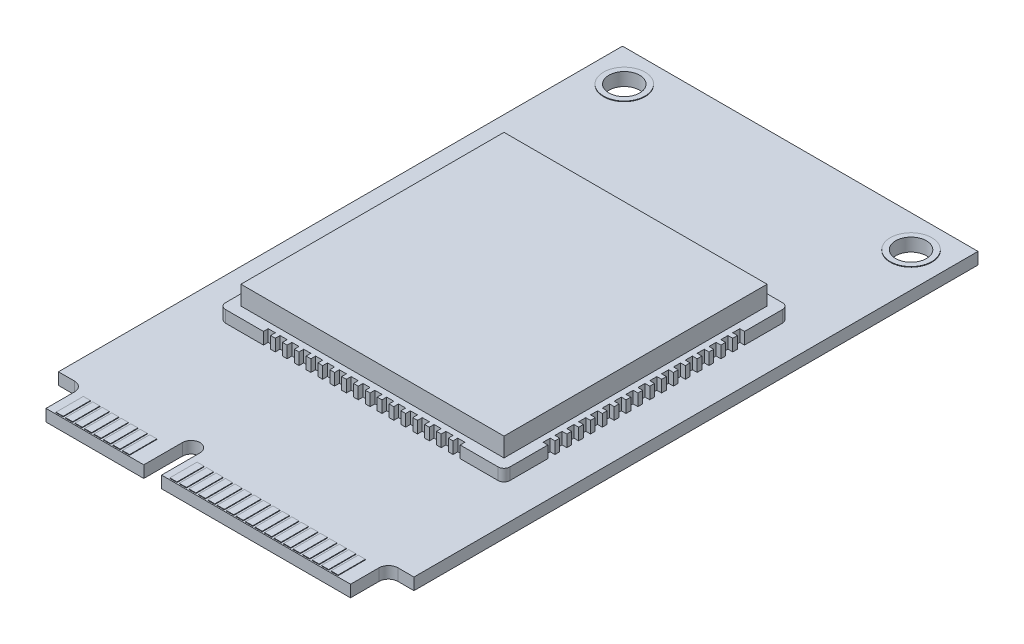
from build123d import *

# Parameters (mm, degrees)
SKETCH1_R           = 1.3
BOSS_EXTRUDE1_DEPTH = 1
SKETCH2_R           = 1.75
SKETCH2_R_2         = 1.3
SKETCH2_W           = 0.6
SKETCH2_H           = 2.3
BOSS_EXTRUDE2_DEPTH = 0.05
BOSS_EXTRUDE3_DEPTH = 1
SKETCH4_W           = 22.2
SKETCH4_H           = 22.2
BOSS_EXTRUDE4_DEPTH = 1.6


with BuildPart() as part:
    # Sketch1 → Boss-Extrude1 (new body)
    with BuildSketch(Plane(origin=(0, 0, 0), x_dir=(1, 0, 0), z_dir=(0, 1, 0))):
        with BuildLine():
            Line((-15, -23.8), (-13.65, -23.8))
            ThreePointArc((-13.65, -23.8), (-13.084314575, -24.034314575), (-12.85, -24.6))
            Line((-12.85, -24.6), (-12.85, -27))
            Line((-12.85, -27), (-4.6, -27))
            Line((-4.6, -27), (-4.6, -23.75))
            ThreePointArc((-4.6, -23.75), (-3.85, -23), (-3.1, -23.75))
            Line((-3.1, -23.75), (-3.1, -27))
            Line((-3.1, -27), (12.85, -27))
            Line((12.85, -27), (12.85, -24.6))
            ThreePointArc((12.85, -24.6), (13.084314575, -24.034314575), (13.65, -23.8))
            Line((13.65, -23.8), (15, -23.8))
            Line((15, -23.8), (15, 23.8))
            Line((15, 23.8), (-15, 23.8))
            Line((-15, 23.8), (-15, -23.8))
        make_face()
        with Locations((12.1, 21.05)):
            Circle(SKETCH1_R, mode=Mode.SUBTRACT)
        with Locations((-12.1, 21.05)):
            Circle(SKETCH1_R, mode=Mode.SUBTRACT)
    extrude(amount=BOSS_EXTRUDE1_DEPTH)

    # Sketch2 → Boss-Extrude2 (add)
    # profile 1 of 28: a face of its own
    with BuildSketch(Plane(origin=(0, 1, 0), x_dir=(1, 0, 0), z_dir=(0, 1, 0))):
        with Locations((-12.1, 21.05)):
            Circle(SKETCH2_R)
        with Locations((-12.1, 21.05)):
            Circle(SKETCH2_R_2, mode=Mode.SUBTRACT)
    # profile 2 of 28: a face of its own
    with BuildSketch(Plane(origin=(0, 1, 0), x_dir=(1, 0, 0), z_dir=(0, 1, 0))):
        with Locations((12.1, 21.05)):
            Circle(SKETCH2_R)
        with Locations((12.1, 21.05)):
            Circle(SKETCH2_R_2, mode=Mode.SUBTRACT)
    # profile 3 of 28: a face of its own
    with BuildSketch(Plane(origin=(0, 1, 0), x_dir=(1, 0, 0), z_dir=(0, 1, 0))):
        with Locations((-6.2, -25.75)):
            Rectangle(SKETCH2_W, SKETCH2_H)
    # profile 4 of 28: a face of its own
    with BuildSketch(Plane(origin=(0, 1, 0), x_dir=(1, 0, 0), z_dir=(0, 1, 0))):
        with Locations((-7, -25.75)):
            Rectangle(SKETCH2_W, SKETCH2_H)
    # profile 5 of 28: a face of its own
    with BuildSketch(Plane(origin=(0, 1, 0), x_dir=(1, 0, 0), z_dir=(0, 1, 0))):
        with Locations((-7.8, -25.75)):
            Rectangle(SKETCH2_W, SKETCH2_H)
    # profile 6 of 28: a face of its own
    with BuildSketch(Plane(origin=(0, 1, 0), x_dir=(1, 0, 0), z_dir=(0, 1, 0))):
        with Locations((-8.6, -25.75)):
            Rectangle(SKETCH2_W, SKETCH2_H)
    # profile 7 of 28: a face of its own
    with BuildSketch(Plane(origin=(0, 1, 0), x_dir=(1, 0, 0), z_dir=(0, 1, 0))):
        with Locations((-9.4, -25.75)):
            Rectangle(SKETCH2_W, SKETCH2_H)
    # profile 8 of 28: a face of its own
    with BuildSketch(Plane(origin=(0, 1, 0), x_dir=(1, 0, 0), z_dir=(0, 1, 0))):
        with Locations((-10.2, -25.75)):
            Rectangle(SKETCH2_W, SKETCH2_H)
    # profile 9 of 28: a face of its own
    with BuildSketch(Plane(origin=(0, 1, 0), x_dir=(1, 0, 0), z_dir=(0, 1, 0))):
        with Locations((-11, -25.75)):
            Rectangle(SKETCH2_W, SKETCH2_H)
    # profile 10 of 28: a face of its own
    with BuildSketch(Plane(origin=(0, 1, 0), x_dir=(1, 0, 0), z_dir=(0, 1, 0))):
        with Locations((-11.8, -25.75)):
            Rectangle(SKETCH2_W, SKETCH2_H)
    # profile 11 of 28: a face of its own
    with BuildSketch(Plane(origin=(0, 1, 0), x_dir=(1, 0, 0), z_dir=(0, 1, 0))):
        with Locations((-2.2, -25.75)):
            Rectangle(SKETCH2_W, SKETCH2_H)
    # profile 12 of 28: a face of its own
    with BuildSketch(Plane(origin=(0, 1, 0), x_dir=(1, 0, 0), z_dir=(0, 1, 0))):
        with Locations((-1.4, -25.75)):
            Rectangle(SKETCH2_W, SKETCH2_H)
    # profile 13 of 28: a face of its own
    with BuildSketch(Plane(origin=(0, 1, 0), x_dir=(1, 0, 0), z_dir=(0, 1, 0))):
        with Locations((-0.6, -25.75)):
            Rectangle(SKETCH2_W, SKETCH2_H)
    # profile 14 of 28: a face of its own
    with BuildSketch(Plane(origin=(0, 1, 0), x_dir=(1, 0, 0), z_dir=(0, 1, 0))):
        with Locations((0.2, -25.75)):
            Rectangle(SKETCH2_W, SKETCH2_H)
    # profile 15 of 28: a face of its own
    with BuildSketch(Plane(origin=(0, 1, 0), x_dir=(1, 0, 0), z_dir=(0, 1, 0))):
        with Locations((1, -25.75)):
            Rectangle(SKETCH2_W, SKETCH2_H)
    # profile 16 of 28: a face of its own
    with BuildSketch(Plane(origin=(0, 1, 0), x_dir=(1, 0, 0), z_dir=(0, 1, 0))):
        with Locations((1.8, -25.75)):
            Rectangle(SKETCH2_W, SKETCH2_H)
    # profile 17 of 28: a face of its own
    with BuildSketch(Plane(origin=(0, 1, 0), x_dir=(1, 0, 0), z_dir=(0, 1, 0))):
        with Locations((2.6, -25.75)):
            Rectangle(SKETCH2_W, SKETCH2_H)
    # profile 18 of 28: a face of its own
    with BuildSketch(Plane(origin=(0, 1, 0), x_dir=(1, 0, 0), z_dir=(0, 1, 0))):
        with Locations((3.4, -25.75)):
            Rectangle(SKETCH2_W, SKETCH2_H)
    # profile 19 of 28: a face of its own
    with BuildSketch(Plane(origin=(0, 1, 0), x_dir=(1, 0, 0), z_dir=(0, 1, 0))):
        with Locations((4.2, -25.75)):
            Rectangle(SKETCH2_W, SKETCH2_H)
    # profile 20 of 28: a face of its own
    with BuildSketch(Plane(origin=(0, 1, 0), x_dir=(1, 0, 0), z_dir=(0, 1, 0))):
        with Locations((5, -25.75)):
            Rectangle(SKETCH2_W, SKETCH2_H)
    # profile 21 of 28: a face of its own
    with BuildSketch(Plane(origin=(0, 1, 0), x_dir=(1, 0, 0), z_dir=(0, 1, 0))):
        with Locations((5.8, -25.75)):
            Rectangle(SKETCH2_W, SKETCH2_H)
    # profile 22 of 28: a face of its own
    with BuildSketch(Plane(origin=(0, 1, 0), x_dir=(1, 0, 0), z_dir=(0, 1, 0))):
        with Locations((6.6, -25.75)):
            Rectangle(SKETCH2_W, SKETCH2_H)
    # profile 23 of 28: a face of its own
    with BuildSketch(Plane(origin=(0, 1, 0), x_dir=(1, 0, 0), z_dir=(0, 1, 0))):
        with Locations((7.4, -25.75)):
            Rectangle(SKETCH2_W, SKETCH2_H)
    # profile 24 of 28: a face of its own
    with BuildSketch(Plane(origin=(0, 1, 0), x_dir=(1, 0, 0), z_dir=(0, 1, 0))):
        with Locations((8.2, -25.75)):
            Rectangle(SKETCH2_W, SKETCH2_H)
    # profile 25 of 28: a face of its own
    with BuildSketch(Plane(origin=(0, 1, 0), x_dir=(1, 0, 0), z_dir=(0, 1, 0))):
        with Locations((9, -25.75)):
            Rectangle(SKETCH2_W, SKETCH2_H)
    # profile 26 of 28: a face of its own
    with BuildSketch(Plane(origin=(0, 1, 0), x_dir=(1, 0, 0), z_dir=(0, 1, 0))):
        with Locations((9.8, -25.75)):
            Rectangle(SKETCH2_W, SKETCH2_H)
    # profile 27 of 28: a face of its own
    with BuildSketch(Plane(origin=(0, 1, 0), x_dir=(1, 0, 0), z_dir=(0, 1, 0))):
        with Locations((10.6, -25.75)):
            Rectangle(SKETCH2_W, SKETCH2_H)
    # profile 28 of 28: a face of its own
    with BuildSketch(Plane(origin=(0, 1, 0), x_dir=(1, 0, 0), z_dir=(0, 1, 0))):
        with Locations((11.4, -25.75)):
            Rectangle(SKETCH2_W, SKETCH2_H)
    boss_extrude2 = extrude(amount=BOSS_EXTRUDE2_DEPTH)

    # Mirror1: Boss-Extrude2 across plane
    add(boss_extrude2.mirror(Plane.ZX.offset(0.5)))

    # Sketch3 → Boss-Extrude3 (add)
    with BuildSketch(Plane(origin=(0, 1, 0), x_dir=(1, 0, 0), z_dir=(0, 1, 0))):
        with BuildLine():
            Line((-8.3, 10.8), (-11.5, 10.8))
            ThreePointArc((-11.5, 10.8), (-11.853553391, 10.653553391), (-12, 10.3))
            Line((-12, 10.3), (-12, 7.1))
            Line((-12, 7.1), (-11.6, 7.1))
            Line((-11.6, 7.1), (-11.6, 6.5))
            Line((-11.6, 6.5), (-12, 6.5))
            Line((-12, 6.5), (-12, 6.1))
            Line((-12, 6.1), (-11.6, 6.1))
            Line((-11.6, 6.1), (-11.6, 5.5))
            Line((-11.6, 5.5), (-12, 5.5))
            Line((-12, 5.5), (-12, 5.1))
            Line((-12, 5.1), (-11.6, 5.1))
            Line((-11.6, 5.1), (-11.6, 4.5))
            Line((-11.6, 4.5), (-12, 4.5))
            Line((-12, 4.5), (-12, 4.1))
            Line((-12, 4.1), (-11.6, 4.1))
            Line((-11.6, 4.1), (-11.6, 3.5))
            Line((-11.6, 3.5), (-12, 3.5))
            Line((-12, 3.5), (-12, 3.1))
            Line((-12, 3.1), (-11.6, 3.1))
            Line((-11.6, 3.1), (-11.6, 2.5))
            Line((-11.6, 2.5), (-12, 2.5))
            Line((-12, 2.5), (-12, 2.1))
            Line((-12, 2.1), (-11.6, 2.1))
            Line((-11.6, 2.1), (-11.6, 1.5))
            Line((-11.6, 1.5), (-12, 1.5))
            Line((-12, 1.5), (-12, 1.1))
            Line((-12, 1.1), (-11.6, 1.1))
            Line((-11.6, 1.1), (-11.6, 0.5))
            Line((-11.6, 0.5), (-12, 0.5))
            Line((-12, 0.5), (-12, 0.1))
            Line((-12, 0.1), (-11.6, 0.1))
            Line((-11.6, 0.1), (-11.6, -0.5))
            Line((-11.6, -0.5), (-12, -0.5))
            Line((-12, -0.5), (-12, -0.9))
            Line((-12, -0.9), (-11.6, -0.9))
            Line((-11.6, -0.9), (-11.6, -1.5))
            Line((-11.6, -1.5), (-12, -1.5))
            Line((-12, -1.5), (-12, -1.9))
            Line((-12, -1.9), (-11.6, -1.9))
            Line((-11.6, -1.9), (-11.6, -2.5))
            Line((-11.6, -2.5), (-12, -2.5))
            Line((-12, -2.5), (-12, -2.9))
            Line((-12, -2.9), (-11.6, -2.9))
            Line((-11.6, -2.9), (-11.6, -3.5))
            Line((-11.6, -3.5), (-12, -3.5))
            Line((-12, -3.5), (-12, -3.9))
            Line((-12, -3.9), (-11.6, -3.9))
            Line((-11.6, -3.9), (-11.6, -4.5))
            Line((-11.6, -4.5), (-12, -4.5))
            Line((-12, -4.5), (-12, -4.9))
            Line((-12, -4.9), (-11.6, -4.9))
            Line((-11.6, -4.9), (-11.6, -5.5))
            Line((-11.6, -5.5), (-12, -5.5))
            Line((-12, -5.5), (-12, -5.9))
            Line((-12, -5.9), (-11.6, -5.9))
            Line((-11.6, -5.9), (-11.6, -6.5))
            Line((-11.6, -6.5), (-12, -6.5))
            Line((-12, -6.5), (-12, -6.9))
            Line((-12, -6.9), (-11.6, -6.9))
            Line((-11.6, -6.9), (-11.6, -7.5))
            Line((-11.6, -7.5), (-12, -7.5))
            Line((-12, -7.5), (-12, -7.9))
            Line((-12, -7.9), (-11.6, -7.9))
            Line((-11.6, -7.9), (-11.6, -8.5))
            Line((-11.6, -8.5), (-12, -8.5))
            Line((-12, -8.5), (-12, -8.9))
            Line((-12, -8.9), (-11.6, -8.9))
            Line((-11.6, -8.9), (-11.6, -9.5))
            Line((-11.6, -9.5), (-12, -9.5))
            Line((-12, -9.5), (-12, -12.7))
            ThreePointArc((-12, -12.7), (-11.853553391, -13.053553391), (-11.5, -13.2))
            Line((-11.5, -13.2), (-8.3, -13.2))
            Line((-8.3, -13.2), (-8.3, -12.8))
            Line((-8.3, -12.8), (-7.7, -12.8))
            Line((-7.7, -12.8), (-7.7, -13.2))
            Line((-7.7, -13.2), (-7.3, -13.2))
            Line((-7.3, -13.2), (-7.3, -12.8))
            Line((-7.3, -12.8), (-6.7, -12.8))
            Line((-6.7, -12.8), (-6.7, -13.2))
            Line((-6.7, -13.2), (-6.3, -13.2))
            Line((-6.3, -13.2), (-6.3, -12.8))
            Line((-6.3, -12.8), (-5.7, -12.8))
            Line((-5.7, -12.8), (-5.7, -13.2))
            Line((-5.7, -13.2), (-5.3, -13.2))
            Line((-5.3, -13.2), (-5.3, -12.8))
            Line((-5.3, -12.8), (-4.7, -12.8))
            Line((-4.7, -12.8), (-4.7, -13.2))
            Line((-4.7, -13.2), (-4.3, -13.2))
            Line((-4.3, -13.2), (-4.3, -12.8))
            Line((-4.3, -12.8), (-3.7, -12.8))
            Line((-3.7, -12.8), (-3.7, -13.2))
            Line((-3.7, -13.2), (-3.3, -13.2))
            Line((-3.3, -13.2), (-3.3, -12.8))
            Line((-3.3, -12.8), (-2.7, -12.8))
            Line((-2.7, -12.8), (-2.7, -13.2))
            Line((-2.7, -13.2), (-2.3, -13.2))
            Line((-2.3, -13.2), (-2.3, -12.8))
            Line((-2.3, -12.8), (-1.7, -12.8))
            Line((-1.7, -12.8), (-1.7, -13.2))
            Line((-1.7, -13.2), (-1.3, -13.2))
            Line((-1.3, -13.2), (-1.3, -12.8))
            Line((-1.3, -12.8), (-0.7, -12.8))
            Line((-0.7, -12.8), (-0.7, -13.2))
            Line((-0.7, -13.2), (-0.3, -13.2))
            Line((-0.3, -13.2), (-0.3, -12.8))
            Line((-0.3, -12.8), (0.3, -12.8))
            Line((0.3, -12.8), (0.3, -13.2))
            Line((0.3, -13.2), (0.7, -13.2))
            Line((0.7, -13.2), (0.7, -12.8))
            Line((0.7, -12.8), (1.3, -12.8))
            Line((1.3, -12.8), (1.3, -13.2))
            Line((1.3, -13.2), (1.7, -13.2))
            Line((1.7, -13.2), (1.7, -12.8))
            Line((1.7, -12.8), (2.3, -12.8))
            Line((2.3, -12.8), (2.3, -13.2))
            Line((2.3, -13.2), (2.7, -13.2))
            Line((2.7, -13.2), (2.7, -12.8))
            Line((2.7, -12.8), (3.3, -12.8))
            Line((3.3, -12.8), (3.3, -13.2))
            Line((3.3, -13.2), (3.7, -13.2))
            Line((3.7, -13.2), (3.7, -12.8))
            Line((3.7, -12.8), (4.3, -12.8))
            Line((4.3, -12.8), (4.3, -13.2))
            Line((4.3, -13.2), (4.7, -13.2))
            Line((4.7, -13.2), (4.7, -12.8))
            Line((4.7, -12.8), (5.3, -12.8))
            Line((5.3, -12.8), (5.3, -13.2))
            Line((5.3, -13.2), (5.7, -13.2))
            Line((5.7, -13.2), (5.7, -12.8))
            Line((5.7, -12.8), (6.3, -12.8))
            Line((6.3, -12.8), (6.3, -13.2))
            Line((6.3, -13.2), (6.7, -13.2))
            Line((6.7, -13.2), (6.7, -12.8))
            Line((6.7, -12.8), (7.3, -12.8))
            Line((7.3, -12.8), (7.3, -13.2))
            Line((7.3, -13.2), (7.7, -13.2))
            Line((7.7, -13.2), (7.7, -12.8))
            Line((7.7, -12.8), (8.3, -12.8))
            Line((8.3, -12.8), (8.3, -13.2))
            Line((8.3, -13.2), (11.5, -13.2))
            ThreePointArc((11.5, -13.2), (11.853553391, -13.053553391), (12, -12.7))
            Line((12, -12.7), (12, -9.5))
            Line((12, -9.5), (11.6, -9.5))
            Line((11.6, -9.5), (11.6, -8.9))
            Line((11.6, -8.9), (12, -8.9))
            Line((12, -8.9), (12, -8.5))
            Line((12, -8.5), (11.6, -8.5))
            Line((11.6, -8.5), (11.6, -7.9))
            Line((11.6, -7.9), (12, -7.9))
            Line((12, -7.9), (12, -7.5))
            Line((12, -7.5), (11.6, -7.5))
            Line((11.6, -7.5), (11.6, -6.9))
            Line((11.6, -6.9), (12, -6.9))
            Line((12, -6.9), (12, -6.5))
            Line((12, -6.5), (11.6, -6.5))
            Line((11.6, -6.5), (11.6, -5.9))
            Line((11.6, -5.9), (12, -5.9))
            Line((12, -5.9), (12, -5.5))
            Line((12, -5.5), (11.6, -5.5))
            Line((11.6, -5.5), (11.6, -4.9))
            Line((11.6, -4.9), (12, -4.9))
            Line((12, -4.9), (12, -4.5))
            Line((12, -4.5), (11.6, -4.5))
            Line((11.6, -4.5), (11.6, -3.9))
            Line((11.6, -3.9), (12, -3.9))
            Line((12, -3.9), (12, -3.5))
            Line((12, -3.5), (11.6, -3.5))
            Line((11.6, -3.5), (11.6, -2.9))
            Line((11.6, -2.9), (12, -2.9))
            Line((12, -2.9), (12, -2.5))
            Line((12, -2.5), (11.6, -2.5))
            Line((11.6, -2.5), (11.6, -1.9))
            Line((11.6, -1.9), (12, -1.9))
            Line((12, -1.9), (12, -1.5))
            Line((12, -1.5), (11.6, -1.5))
            Line((11.6, -1.5), (11.6, -0.9))
            Line((11.6, -0.9), (12, -0.9))
            Line((12, -0.9), (12, -0.5))
            Line((12, -0.5), (11.6, -0.5))
            Line((11.6, -0.5), (11.6, 0.1))
            Line((11.6, 0.1), (12, 0.1))
            Line((12, 0.1), (12, 0.5))
            Line((12, 0.5), (11.6, 0.5))
            Line((11.6, 0.5), (11.6, 1.1))
            Line((11.6, 1.1), (12, 1.1))
            Line((12, 1.1), (12, 1.5))
            Line((12, 1.5), (11.6, 1.5))
            Line((11.6, 1.5), (11.6, 2.1))
            Line((11.6, 2.1), (12, 2.1))
            Line((12, 2.1), (12, 2.5))
            Line((12, 2.5), (11.6, 2.5))
            Line((11.6, 2.5), (11.6, 3.1))
            Line((11.6, 3.1), (12, 3.1))
            Line((12, 3.1), (12, 3.5))
            Line((12, 3.5), (11.6, 3.5))
            Line((11.6, 3.5), (11.6, 4.1))
            Line((11.6, 4.1), (12, 4.1))
            Line((12, 4.1), (12, 4.5))
            Line((12, 4.5), (11.6, 4.5))
            Line((11.6, 4.5), (11.6, 5.1))
            Line((11.6, 5.1), (12, 5.1))
            Line((12, 5.1), (12, 5.5))
            Line((12, 5.5), (11.6, 5.5))
            Line((11.6, 5.5), (11.6, 6.1))
            Line((11.6, 6.1), (12, 6.1))
            Line((12, 6.1), (12, 6.5))
            Line((12, 6.5), (11.6, 6.5))
            Line((11.6, 6.5), (11.6, 7.1))
            Line((11.6, 7.1), (12, 7.1))
            Line((12, 7.1), (12, 10.3))
            ThreePointArc((12, 10.3), (11.853553391, 10.653553391), (11.5, 10.8))
            Line((11.5, 10.8), (8.3, 10.8))
            Line((8.3, 10.8), (8.3, 10.4))
            Line((8.3, 10.4), (7.7, 10.4))
            Line((7.7, 10.4), (7.7, 10.8))
            Line((7.7, 10.8), (7.3, 10.8))
            Line((7.3, 10.8), (7.3, 10.4))
            Line((7.3, 10.4), (6.7, 10.4))
            Line((6.7, 10.4), (6.7, 10.8))
            Line((6.7, 10.8), (6.3, 10.8))
            Line((6.3, 10.8), (6.3, 10.4))
            Line((6.3, 10.4), (5.7, 10.4))
            Line((5.7, 10.4), (5.7, 10.8))
            Line((5.7, 10.8), (5.3, 10.8))
            Line((5.3, 10.8), (5.3, 10.4))
            Line((5.3, 10.4), (4.7, 10.4))
            Line((4.7, 10.4), (4.7, 10.8))
            Line((4.7, 10.8), (4.3, 10.8))
            Line((4.3, 10.8), (4.3, 10.4))
            Line((4.3, 10.4), (3.7, 10.4))
            Line((3.7, 10.4), (3.7, 10.8))
            Line((3.7, 10.8), (3.3, 10.8))
            Line((3.3, 10.8), (3.3, 10.4))
            Line((3.3, 10.4), (2.7, 10.4))
            Line((2.7, 10.4), (2.7, 10.8))
            Line((2.7, 10.8), (2.3, 10.8))
            Line((2.3, 10.8), (2.3, 10.4))
            Line((2.3, 10.4), (1.7, 10.4))
            Line((1.7, 10.4), (1.7, 10.8))
            Line((1.7, 10.8), (1.3, 10.8))
            Line((1.3, 10.8), (1.3, 10.4))
            Line((1.3, 10.4), (0.7, 10.4))
            Line((0.7, 10.4), (0.7, 10.8))
            Line((0.7, 10.8), (0.3, 10.8))
            Line((0.3, 10.8), (0.3, 10.4))
            Line((0.3, 10.4), (-0.3, 10.4))
            Line((-0.3, 10.4), (-0.3, 10.8))
            Line((-0.3, 10.8), (-0.7, 10.8))
            Line((-0.7, 10.8), (-0.7, 10.4))
            Line((-0.7, 10.4), (-1.3, 10.4))
            Line((-1.3, 10.4), (-1.3, 10.8))
            Line((-1.3, 10.8), (-1.7, 10.8))
            Line((-1.7, 10.8), (-1.7, 10.4))
            Line((-1.7, 10.4), (-2.3, 10.4))
            Line((-2.3, 10.4), (-2.3, 10.8))
            Line((-2.3, 10.8), (-2.7, 10.8))
            Line((-2.7, 10.8), (-2.7, 10.4))
            Line((-2.7, 10.4), (-3.3, 10.4))
            Line((-3.3, 10.4), (-3.3, 10.8))
            Line((-3.3, 10.8), (-3.7, 10.8))
            Line((-3.7, 10.8), (-3.7, 10.4))
            Line((-3.7, 10.4), (-4.3, 10.4))
            Line((-4.3, 10.4), (-4.3, 10.8))
            Line((-4.3, 10.8), (-4.7, 10.8))
            Line((-4.7, 10.8), (-4.7, 10.4))
            Line((-4.7, 10.4), (-5.3, 10.4))
            Line((-5.3, 10.4), (-5.3, 10.8))
            Line((-5.3, 10.8), (-5.7, 10.8))
            Line((-5.7, 10.8), (-5.7, 10.4))
            Line((-5.7, 10.4), (-6.3, 10.4))
            Line((-6.3, 10.4), (-6.3, 10.8))
            Line((-6.3, 10.8), (-6.7, 10.8))
            Line((-6.7, 10.8), (-6.7, 10.4))
            Line((-6.7, 10.4), (-7.3, 10.4))
            Line((-7.3, 10.4), (-7.3, 10.8))
            Line((-7.3, 10.8), (-7.7, 10.8))
            Line((-7.7, 10.8), (-7.7, 10.4))
            Line((-7.7, 10.4), (-8.3, 10.4))
            Line((-8.3, 10.4), (-8.3, 10.8))
        make_face()
    extrude(amount=BOSS_EXTRUDE3_DEPTH)

    # Sketch4 → Boss-Extrude4 (add)
    with BuildSketch(Plane(origin=(0, 2, 0), x_dir=(1, 0, 0), z_dir=(0, 1, 0))):
        with Locations((0, -1.2)):
            Rectangle(SKETCH4_W, SKETCH4_H)
    extrude(amount=BOSS_EXTRUDE4_DEPTH)


solid = part.part
